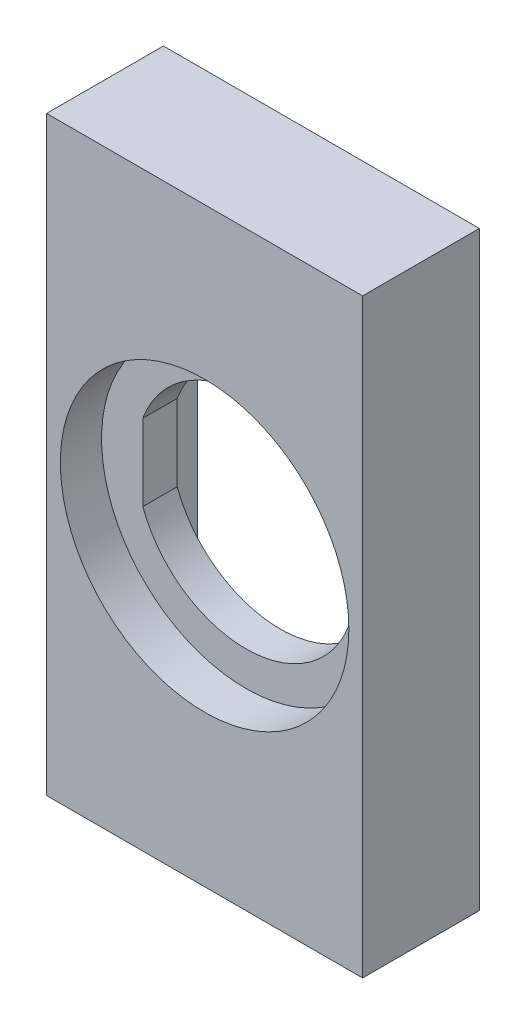
from build123d import *

# Parameters (mm, degrees)
ESBO_O1_W                = 23
ESBO_O1_H                = 43
RESSALTO_EXTRUS_O1_DEPTH = 8.5
CORTE_EXTRUS_O2_DEPTH    = 26.821502667
ESBO_O5_R                = 10.5
CORTE_EXTRUS_O4_DEPTH    = 3
ESBO_O6_W                = 18
ESBO_O6_H                = 38
CORTE_EXTRUS_O5_DEPTH    = 3
CORTE_EXTRUS_O6_DEPTH    = 1


with BuildPart() as part:
    # Esboço1 → Ressalto-extrusão1 (new body)
    with BuildSketch(Plane.XY):
        Rectangle(ESBO_O1_W, ESBO_O1_H)
    extrude(amount=RESSALTO_EXTRUS_O1_DEPTH)

    # Esboço3 → Corte-extrusão2 (cut, through all)
    with BuildSketch(Plane.XY.offset(8.5)):
        with BuildLine():
            Line((-7.5, 2.783882181), (-7.5, -2.783882181))
            ThreePointArc((-7.5, -2.783882181), (0, -8), (7.5, -2.783882181))
            Line((7.5, -2.783882181), (7.5, 2.783882181))
            ThreePointArc((7.5, 2.783882181), (0, 8), (-7.5, 2.783882181))
        make_face()
    extrude(amount=-CORTE_EXTRUS_O2_DEPTH, mode=Mode.SUBTRACT)

    # Esboço5 → Corte-extrusão4 (cut)
    with BuildSketch(Plane.XY.offset(8.5)):
        Circle(ESBO_O5_R)
    extrude(amount=-CORTE_EXTRUS_O4_DEPTH, mode=Mode.SUBTRACT)

    # Esboço6 → Corte-extrusão5 (cut)
    with BuildSketch(Plane(origin=(0, 0, 0), x_dir=(-1, 0, 0), z_dir=(0, 0, -1))):
        Rectangle(ESBO_O6_W, ESBO_O6_H)
    extrude(amount=-CORTE_EXTRUS_O5_DEPTH, mode=Mode.SUBTRACT)

    # Esboço7 → Corte-extrusão6 (cut)
    with BuildSketch(Plane(origin=(0, 0, 3), x_dir=(-1, 0, 0), z_dir=(0, 0, -1))):
        with BuildLine():
            Line((-9, -19), (-9, -6.32455532))
            ThreePointArc((-9, -6.32455532), (0, -11), (9, -6.32455532))
            Line((9, -6.32455532), (9, -19))
            Line((9, -19), (-9, -19))
        make_face()
        with BuildLine():
            Line((-9, 19), (9, 19))
            Line((9, 19), (9, 6.32455532))
            ThreePointArc((9, 6.32455532), (0, 11), (-9, 6.32455532))
            Line((-9, 6.32455532), (-9, 19))
        make_face()
    extrude(amount=-CORTE_EXTRUS_O6_DEPTH, mode=Mode.SUBTRACT)


solid = part.part
